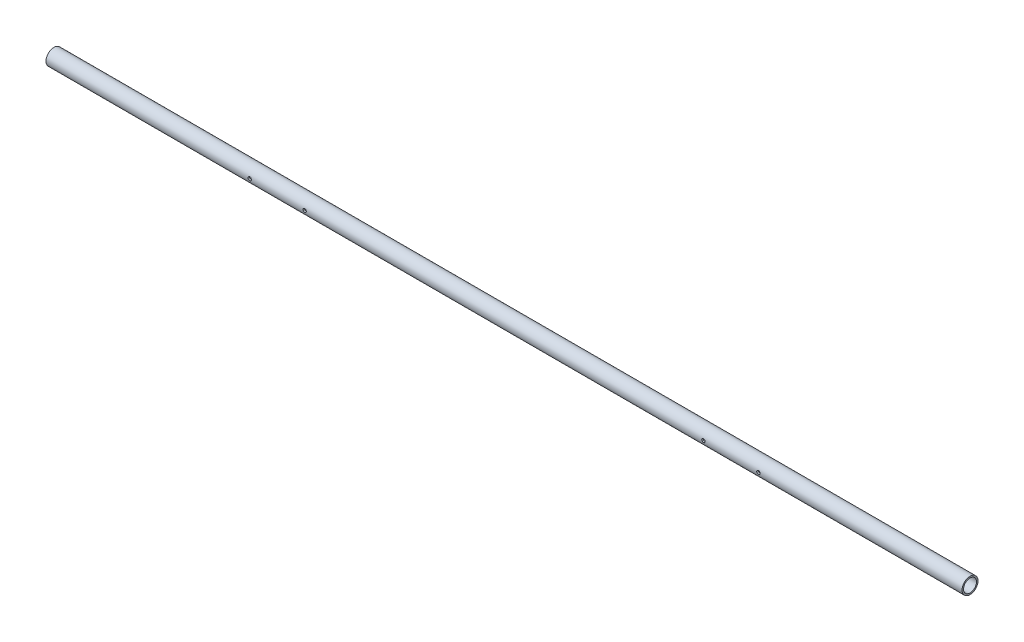
from build123d import *

# Parameters (mm, degrees)
BOSS_EXTRUDE1_DEPTH                 = 215.9
BOSS_EXTRUDE1_DEPTH_BACK            = 215.9
SKETCH1_R                           = 3.7592
SKETCH1_R_2                         = 3.048
CUT_EXTRUDE1_REACH                  = 217.965
CUT_EXTRUDE1_END_RADIUS             = 3.7592
SKETCH2_R                           = 0.777875
CUT_EXTRUDE1_DIRECTION_2_REACH      = 217.965
CUT_EXTRUDE1_DIRECTION_2_END_RADIUS = 3.7592


with BuildPart() as part:
    # Sketch1 → Boss-Extrude1 (new, two sides: drawn at the far end of the back side and taken through both)
    with BuildSketch(Plane(origin=(0, 0, 0), x_dir=(0, 0, -1), z_dir=(1, 0, 0)).offset(-BOSS_EXTRUDE1_DEPTH_BACK)):
        Circle(SKETCH1_R)
        Circle(SKETCH1_R_2, mode=Mode.SUBTRACT)
    extrude(amount=BOSS_EXTRUDE1_DEPTH + BOSS_EXTRUDE1_DEPTH_BACK)

    # Cut-Extrude1: up to this cylinder (the profile starts inside it)
    cut_extrude1_end = Plane(origin=(0, 0, 0), z_dir=(1, 0, 0)) * Cylinder(CUT_EXTRUDE1_END_RADIUS, 684.2244, mode=Mode.PRIVATE)
    # Sketch2 → Cut-Extrude1 (cut, up to the surface)
    with BuildSketch(Plane.XY, mode=Mode.PRIVATE) as cut_extrude1_sk1:
        with Locations((93.98, 0)):
            Circle(SKETCH2_R)
    cut_extrude1_tool1 = extrude(cut_extrude1_sk1.sketch, amount=-CUT_EXTRUDE1_REACH, mode=Mode.PRIVATE) & cut_extrude1_end
    add(cut_extrude1_tool1.solids().sort_by_distance((93.98, 0, 0))[0], mode=Mode.SUBTRACT)
    # Sketch2 → Cut-Extrude1 (cut, up to the surface)
    with BuildSketch(Plane.XY, mode=Mode.PRIVATE) as cut_extrude1_sk2:
        with Locations((119.888, 0)):
            Circle(SKETCH2_R)
    cut_extrude1_tool2 = extrude(cut_extrude1_sk2.sketch, amount=-CUT_EXTRUDE1_REACH, mode=Mode.PRIVATE) & cut_extrude1_end
    add(cut_extrude1_tool2.solids().sort_by_distance((119.888, 0, 0))[0], mode=Mode.SUBTRACT)
    # Sketch2 → Cut-Extrude1 (cut, up to the surface)
    with BuildSketch(Plane.XY, mode=Mode.PRIVATE) as cut_extrude1_sk3:
        with Locations((-119.888, 0)):
            Circle(SKETCH2_R)
    cut_extrude1_tool3 = extrude(cut_extrude1_sk3.sketch, amount=-CUT_EXTRUDE1_REACH, mode=Mode.PRIVATE) & cut_extrude1_end
    add(cut_extrude1_tool3.solids().sort_by_distance((-119.888, 0, 0))[0], mode=Mode.SUBTRACT)
    # Sketch2 → Cut-Extrude1 (cut, up to the surface)
    with BuildSketch(Plane.XY, mode=Mode.PRIVATE) as cut_extrude1_sk4:
        with Locations((-93.98, 0)):
            Circle(SKETCH2_R)
    cut_extrude1_tool4 = extrude(cut_extrude1_sk4.sketch, amount=-CUT_EXTRUDE1_REACH, mode=Mode.PRIVATE) & cut_extrude1_end
    add(cut_extrude1_tool4.solids().sort_by_distance((-93.98, 0, 0))[0], mode=Mode.SUBTRACT)

    # Cut-Extrude1 direction 2: up to this cylinder (the profile starts inside it)
    cut_extrude1_direction_2_end = Plane(origin=(0, 0, 0), z_dir=(1, 0, 0)) * Cylinder(CUT_EXTRUDE1_DIRECTION_2_END_RADIUS, 684.2244, mode=Mode.PRIVATE)
    # Sketch2 → Cut-Extrude1 direction 2 (cut, up to the surface)
    with BuildSketch(Plane.XY, mode=Mode.PRIVATE) as cut_extrude1_direction_2_sk1:
        with Locations((93.98, 0)):
            Circle(SKETCH2_R)
    cut_extrude1_direction_2_tool1 = extrude(cut_extrude1_direction_2_sk1.sketch, amount=CUT_EXTRUDE1_DIRECTION_2_REACH, mode=Mode.PRIVATE) & cut_extrude1_direction_2_end
    add(cut_extrude1_direction_2_tool1.solids().sort_by_distance((93.98, 0, 0))[0], mode=Mode.SUBTRACT)
    # Sketch2 → Cut-Extrude1 direction 2 (cut, up to the surface)
    with BuildSketch(Plane.XY, mode=Mode.PRIVATE) as cut_extrude1_direction_2_sk2:
        with Locations((119.888, 0)):
            Circle(SKETCH2_R)
    cut_extrude1_direction_2_tool2 = extrude(cut_extrude1_direction_2_sk2.sketch, amount=CUT_EXTRUDE1_DIRECTION_2_REACH, mode=Mode.PRIVATE) & cut_extrude1_direction_2_end
    add(cut_extrude1_direction_2_tool2.solids().sort_by_distance((119.888, 0, 0))[0], mode=Mode.SUBTRACT)
    # Sketch2 → Cut-Extrude1 direction 2 (cut, up to the surface)
    with BuildSketch(Plane.XY, mode=Mode.PRIVATE) as cut_extrude1_direction_2_sk3:
        with Locations((-119.888, 0)):
            Circle(SKETCH2_R)
    cut_extrude1_direction_2_tool3 = extrude(cut_extrude1_direction_2_sk3.sketch, amount=CUT_EXTRUDE1_DIRECTION_2_REACH, mode=Mode.PRIVATE) & cut_extrude1_direction_2_end
    add(cut_extrude1_direction_2_tool3.solids().sort_by_distance((-119.888, 0, 0))[0], mode=Mode.SUBTRACT)
    # Sketch2 → Cut-Extrude1 direction 2 (cut, up to the surface)
    with BuildSketch(Plane.XY, mode=Mode.PRIVATE) as cut_extrude1_direction_2_sk4:
        with Locations((-93.98, 0)):
            Circle(SKETCH2_R)
    cut_extrude1_direction_2_tool4 = extrude(cut_extrude1_direction_2_sk4.sketch, amount=CUT_EXTRUDE1_DIRECTION_2_REACH, mode=Mode.PRIVATE) & cut_extrude1_direction_2_end
    add(cut_extrude1_direction_2_tool4.solids().sort_by_distance((-93.98, 0, 0))[0], mode=Mode.SUBTRACT)


solid = part.part
